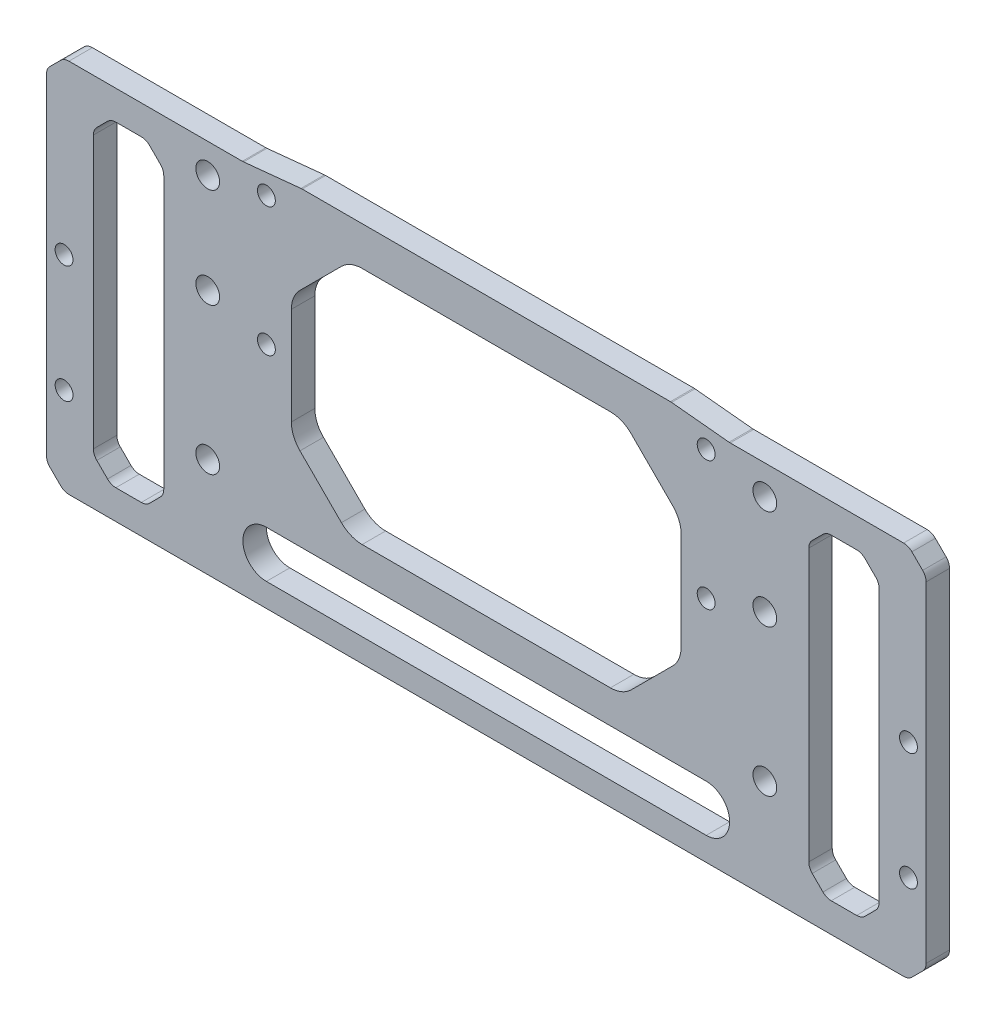
from build123d import *

# Parameters (mm, degrees)
SKETCH_1_W          = 105
SKETCH_1_H          = 52
SKETCH_1_R          = 2.025
SKETCH_1_R_2        = 1.525
SKETCH_1_W_2        = 83
SKETCH_1_H_2        = 1
EXTRUDE_3_DEPTH     = 4
SKETCH_3_W          = 105
SKETCH_3_H          = 12
EXTRUDE_4_DEPTH     = 4
SKETCH_6_W          = 66.47562141
SKETCH_6_H          = 40.771714464
CUT_EXTRUDE_1_DEPTH = 4
CHAMFER_1_SIZE      = 10
FILLET_2_R          = 5
SKETCH_7_W          = 20
SKETCH_7_H          = 64
SKETCH_7_R          = 1.525
EXTRUDE_5_DEPTH     = 4
SKETCH_8_W          = 12
SKETCH_8_H          = 54
CUT_EXTRUDE_2_DEPTH = 10
CUT_EXTRUDE_3_DEPTH = 10
CHAMFER_2_SIZE      = 3
FILLET_3_R          = 2


with BuildPart() as part:
    # 草图1 → 凸台-拉伸3 (new body)
    # profile 1 of 2: a face of its own
    with BuildSketch(Plane.XY):
        Rectangle(SKETCH_1_W, SKETCH_1_H)
        with Locations((-47.5, 4)):
            Circle(SKETCH_1_R, mode=Mode.SUBTRACT)
        with Locations((-47.5, 21)):
            Circle(SKETCH_1_R, mode=Mode.SUBTRACT)
        with Locations((-47.5, -21)):
            Circle(SKETCH_1_R, mode=Mode.SUBTRACT)
        with Locations((47.5, 21)):
            Circle(SKETCH_1_R, mode=Mode.SUBTRACT)
        with Locations((47.5, 4)):
            Circle(SKETCH_1_R, mode=Mode.SUBTRACT)
        with Locations((47.5, -21)):
            Circle(SKETCH_1_R, mode=Mode.SUBTRACT)
        with Locations((-37.5, 23)):
            Circle(SKETCH_1_R_2, mode=Mode.SUBTRACT)
        with Locations((-37.5, 1)):
            Circle(SKETCH_1_R_2, mode=Mode.SUBTRACT)
        with Locations((37.5, 23)):
            Circle(SKETCH_1_R_2, mode=Mode.SUBTRACT)
        with Locations((37.5, 1)):
            Circle(SKETCH_1_R_2, mode=Mode.SUBTRACT)
    # profile 2 of 2: a face of its own
    with BuildSketch(Plane.XY):
        with Locations((0, 26.5)):
            Rectangle(SKETCH_1_W_2, SKETCH_1_H_2)
    extrude(amount=EXTRUDE_3_DEPTH)

    # 草图3 → 凸台-拉伸4 (add)
    with BuildSketch(Plane.XY.offset(4)):
        with Locations((0, -32)):
            Rectangle(SKETCH_3_W, SKETCH_3_H)
        Polygon((-52.5, -26), (-52.5, 26), (-55, 26), (-55, -38), (-52.5, -38), align=None)
        Polygon((52.5, -38), (55, -38), (55, 26), (52.5, 26), (52.5, -26), align=None)
    extrude(amount=-EXTRUDE_4_DEPTH)

    # 草图6 → 切除-拉伸1 (cut)
    with BuildSketch(Plane(origin=(0, 0, 0), x_dir=(-1, 0, 0), z_dir=(0, 0, -1))):
        Rectangle(SKETCH_6_W, SKETCH_6_H)
    extrude(amount=-CUT_EXTRUDE_1_DEPTH, mode=Mode.SUBTRACT)

    # 倒角1
    chamfer_1_edges = [part.edges().sort_by_distance(p)[0] for p in [
        (-33.237810705, -20.385857232, 2),
        (33.237810705, -20.385857232, 2),
        (33.237810705, 20.385857232, 2),
        (-33.237810705, 20.385857232, 2),
    ]]
    chamfer(chamfer_1_edges, length=CHAMFER_1_SIZE)

    # 圆角2
    fillet_2_edges = [part.edges().sort_by_distance(p)[0] for p in [
        (-33.237810705, 10.385857232, 2),
        (-33.237810705, -10.385857232, 2),
        (23.237810705, -20.385857232, 2),
        (-23.237810705, -20.385857232, 2),
        (23.237810705, 20.385857232, 2),
        (-23.237810705, 20.385857232, 2),
        (33.237810705, -10.385857232, 2),
        (33.237810705, 10.385857232, 2),
    ]]
    fillet(fillet_2_edges, radius=FILLET_2_R)

    # 草图7 → 凸台-拉伸5 (add)
    # profile 1 of 2: a face of its own
    with BuildSketch(Plane.XY.offset(4)):
        with Locations((-65, -6)):
            Rectangle(SKETCH_7_W, SKETCH_7_H)
        with Locations((-72, -3)):
            Circle(SKETCH_7_R, mode=Mode.SUBTRACT)
        with Locations((-72, -23)):
            Circle(SKETCH_7_R, mode=Mode.SUBTRACT)
    # profile 2 of 2: a face of its own
    with BuildSketch(Plane.XY.offset(4)):
        with Locations((65, -6)):
            Rectangle(SKETCH_7_W, SKETCH_7_H)
        with Locations((72, -23)):
            Circle(SKETCH_7_R, mode=Mode.SUBTRACT)
        with Locations((72, -3)):
            Circle(SKETCH_7_R, mode=Mode.SUBTRACT)
    extrude(amount=-EXTRUDE_5_DEPTH)

    # 草图8 → 切除-拉伸2 (cut)
    with BuildSketch(Plane.XY.offset(4)):
        with Locations((-61, -6)):
            Rectangle(SKETCH_8_W, SKETCH_8_H)
        with Locations((61, -6)):
            Rectangle(SKETCH_8_W, SKETCH_8_H)
    extrude(amount=-CUT_EXTRUDE_2_DEPTH, mode=Mode.SUBTRACT)

    # 草图9 → 切除-拉伸3 (cut)
    with BuildSketch(Plane.XY.offset(4)):
        Polygon((41.5, 26), (31.5, 27), (41.5, 27), align=None)
        Polygon((-41.5, 27), (-41.5, 26), (-31.5, 27), align=None)
        with BuildLine():
            Line((-37.5, -26), (37.5, -26))
            ThreePointArc((37.5, -26), (41.5, -30), (37.5, -34))
            Line((37.5, -34), (-37.5, -34))
            ThreePointArc((-37.5, -34), (-41.5, -30), (-37.5, -26))
        make_face()
    extrude(amount=-CUT_EXTRUDE_3_DEPTH, mode=Mode.SUBTRACT)

    # 倒角2
    chamfer_2_edges = [part.edges().sort_by_distance(p)[0] for p in [
        (-75, 26, 2),
        (-75, -38, 2),
        (75, -38, 2),
        (75, 26, 2),
        (-67, -33, 2),
        (-67, 21, 2),
        (-55, 21, 2),
        (-55, -33, 2),
        (67, 21, 2),
        (67, -33, 2),
        (55, -33, 2),
        (55, 21, 2),
    ]]
    chamfer(chamfer_2_edges, length=CHAMFER_2_SIZE)

    # 圆角3
    # the kernel refuses this fillet: 2 mm, written as the material it adds along each edge
    with BuildSketch(Plane(origin=(41.5, 26, 0), x_dir=(1, 0, 0), z_dir=(0, 0, 1)), Plane(origin=(-41.5, 26, 0), x_dir=(0.9950371902099869, 0.09950371902102007, 0), z_dir=(0, 0, 1))) as fillet_3_piece_1:
        with BuildLine():
            CenterArc((FILLET_3_R * 0.0498756211208, FILLET_3_R), FILLET_3_R, 264.289406863, 5.710593137)
            Line((-FILLET_3_R * 0.0496280979001, FILLET_3_R * 0.00496280979), (0, 0))
            Line((0, 0), (FILLET_3_R * 0.0498756211209, 0))
        make_face()
    extrude(amount=4)
    with BuildSketch(Plane(origin=(-58, -33, 4), x_dir=(-1, 0, 0), z_dir=(0, 0, -1)), Plane(origin=(-64, -33, 4), x_dir=(-0.7071067811865475, 0.7071067811865475, 0), z_dir=(0, 0, -1)), Plane(origin=(-67, -30, 4), x_dir=(0, 1, 0), z_dir=(0, 0, -1)), Plane(origin=(-55, -30, 4), x_dir=(-0.7071067811865454, -0.7071067811865497, 0), z_dir=(0, 0, -1)), Plane(origin=(55, 18, 4), x_dir=(0.7071067811865475, 0.7071067811865475, 0), z_dir=(0, 0, -1)), Plane(origin=(67, 18, 4), x_dir=(0, -1, 0), z_dir=(0, 0, -1)), Plane(origin=(64, 21, 4), x_dir=(0.7071067811865475, -0.7071067811865475, 0), z_dir=(0, 0, -1)), Plane(origin=(58, 21, 4), x_dir=(1, 0, 0), z_dir=(0, 0, -1))) as fillet_3_piece_2:
        with BuildLine():
            CenterArc((FILLET_3_R * 0.414213562373, FILLET_3_R), FILLET_3_R, 225, 45)
            Line((-FILLET_3_R * 0.292893218813, FILLET_3_R * 0.292893218813), (0, 0))
            Line((0, 0), (FILLET_3_R * 0.414213562373, 0))
        make_face()
    extrude(amount=4)
    with BuildSketch(Plane(origin=(-67, 18, 4), x_dir=(0, -1, 0), z_dir=(0, 0, -1)), Plane(origin=(-55, 18, 4), x_dir=(-0.7071067811865475, 0.7071067811865475, 0), z_dir=(0, 0, -1)), Plane(origin=(-58, 21, 4), x_dir=(-1, 0, 0), z_dir=(0, 0, -1)), Plane(origin=(-64, 21, 4), x_dir=(-0.7071067811865475, -0.7071067811865475, 0), z_dir=(0, 0, -1)), Plane(origin=(64, -33, 4), x_dir=(0.7071067811865475, 0.7071067811865475, 0), z_dir=(0, 0, -1)), Plane(origin=(58, -33, 4), x_dir=(1, 0, 0), z_dir=(0, 0, -1)), Plane(origin=(55, -30, 4), x_dir=(0.7071067811865475, -0.7071067811865475, 0), z_dir=(0, 0, -1)), Plane(origin=(67, -30, 4), x_dir=(0, 1, 0), z_dir=(0, 0, -1))) as fillet_3_piece_3:
        with BuildLine():
            CenterArc((FILLET_3_R * 0.414213562373, -FILLET_3_R), FILLET_3_R, 90, 45)
            Line((-FILLET_3_R * 0.292893218813, -FILLET_3_R * 0.292893218813), (0, 0))
            Line((0, 0), (FILLET_3_R * 0.414213562373, 0))
        make_face()
    extrude(amount=4)
    # the kernel refuses this fillet: 2 mm, written as the material it takes off along each edge
    with BuildSketch(Plane(origin=(-31.5, 27, 4.249378106), x_dir=(1, 0, 0), z_dir=(0, 0, -1)), Plane(origin=(31.5, 27, 4.249378106), x_dir=(0.9950371902099905, -0.0995037190209848, 0), z_dir=(0, 0, -1))) as fillet_3_2_piece_1:
        with BuildLine():
            CenterArc((FILLET_3_R * 0.0498756211209, FILLET_3_R), FILLET_3_R, 264.289406863, 5.710593137)
            Line((-FILLET_3_R * 0.0496280979001, FILLET_3_R * 0.00496280979001), (0, 0))
            Line((0, 0), (FILLET_3_R * 0.0498756211209, 0))
        make_face()
    extrude(amount=4.498756211, mode=Mode.SUBTRACT)
    with BuildSketch(Plane(origin=(-72, -38, 6.071067812), x_dir=(1, 0, 0), z_dir=(0, 0, -1)), Plane(origin=(72, -38, 6.071067812), x_dir=(0.7071067811865475, 0.7071067811865475, 0), z_dir=(0, 0, -1)), Plane(origin=(75, 23, 6.071067812), x_dir=(-0.7071067811865475, 0.7071067811865475, 0), z_dir=(0, 0, -1)), Plane(origin=(75, -35, 6.071067812), x_dir=(0, 1, 0), z_dir=(0, 0, -1)), Plane(origin=(72, 26, 6.071067812), x_dir=(-1, 0, 0), z_dir=(0, 0, -1)), Plane(origin=(-75, -35, 6.071067812), x_dir=(0.7071067811865475, -0.7071067811865475, 0), z_dir=(0, 0, -1))) as fillet_3_2_piece_2:
        with BuildLine():
            CenterArc((FILLET_3_R * 0.414213562373, -FILLET_3_R), FILLET_3_R, 90, 45)
            Line((-FILLET_3_R * 0.292893218813, -FILLET_3_R * 0.292893218813), (0, 0))
            Line((0, 0), (FILLET_3_R * 0.414213562373, 0))
        make_face()
    extrude(amount=8.142135624, mode=Mode.SUBTRACT)
    with BuildSketch(Plane(origin=(-72, 26, 6.071067812), x_dir=(1, 0, 0), z_dir=(0, 0, -1)), Plane(origin=(-75, 23, 6.071067812), x_dir=(0.7071067811865497, 0.7071067811865454, 0), z_dir=(0, 0, -1))) as fillet_3_2_piece_3:
        with BuildLine():
            CenterArc((FILLET_3_R * 0.414213562373, FILLET_3_R), FILLET_3_R, 225, 45)
            Line((-FILLET_3_R * 0.292893218813, FILLET_3_R * 0.292893218813), (0, 0))
            Line((0, 0), (FILLET_3_R * 0.414213562373, 0))
        make_face()
    extrude(amount=8.142135624, mode=Mode.SUBTRACT)


solid = part.part
